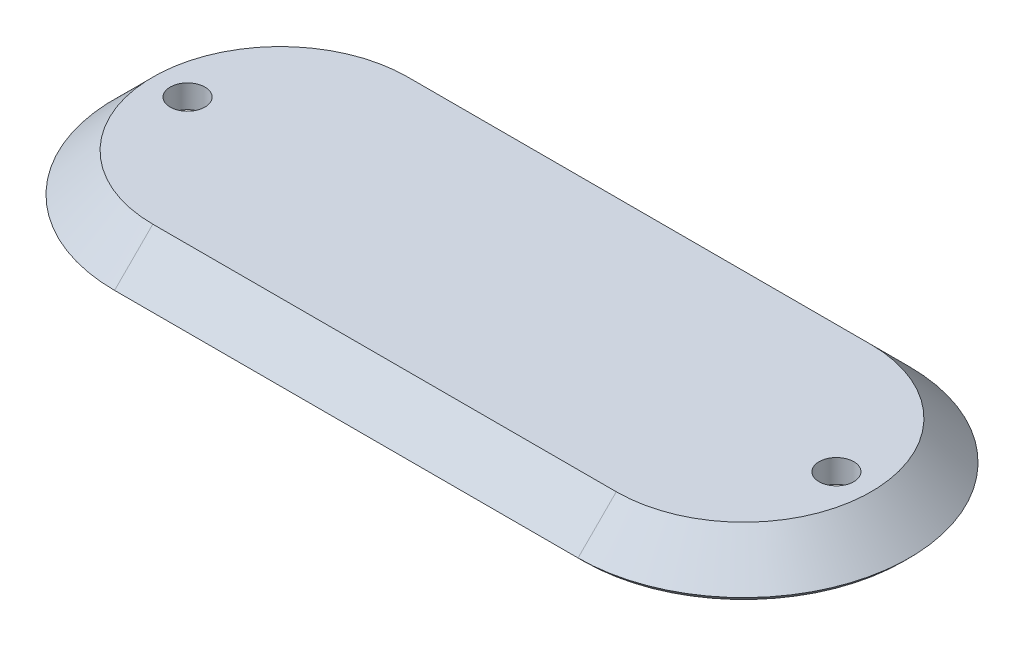
from build123d import *
from OCP.BRepFilletAPI import BRepFilletAPI_MakeChamfer

# Parameters (mm, degrees)
BOSS_EXTRU_1_DEPTH      = 3.8
BOSS_EXTRU_1_TAPER      = 45
COQUE2_DEPTH            = 1.8
COQUE2_DRAFT            = 45
CHANFREIN1_SIZE         = 1
CHANFREIN1_SIZE2        = 0.707106781
ENL_V_MAT_EXTRU_1_REACH = 39.355
ESQUISSE2_R             = 1.5


# Read off the part's stored shape, not the designer's step: Coque2
with BuildPart() as part:
    # Esquisse1 → Boss.-Extru.1 (new body)
    with BuildSketch(Plane(origin=(0, 0, 0), x_dir=(1, 0, 0), z_dir=(0, 1, 0))):
        with BuildLine():
            ThreePointArc((-20, 14.8), (-34.8, 0), (-20, -14.8))
            Line((-20, -14.8), (20, -14.8))
            ThreePointArc((20, -14.8), (34.8, 0), (20, 14.8))
            Line((20, 14.8), (-20, 14.8))
        make_face()
    extrude(amount=BOSS_EXTRU_1_DEPTH, taper=BOSS_EXTRU_1_TAPER)


with BuildPart() as coque2_tool:
    # Coque2 outline → Coque2 (with draft: the straight prism first)
    with BuildSketch(Plane(origin=(0, 1.8, 0), x_dir=(1, 0, 0), z_dir=(0, 1, 0))):
        with BuildLine():
            Line((-20, -10.171572875), (20, -10.171572875))
            ThreePointArc((20, -10.171572875), (30.171572875, 0), (20, 10.171572875))
            Line((20, 10.171572875), (-20, 10.171572875))
            ThreePointArc((-20, 10.171572875), (-30.171572875, 0), (-20, -10.171572875))
        make_face()
    extrude(amount=-COQUE2_DEPTH)
    # Coque2: the draft: its side faces are tilted about the plane it starts from
    coque2_sides = [coque2_tool.faces().sort_by_distance(p)[0] for p in [
        (0, 0.9, 10.171572875),
        (30.171572875, 0.9, 0),
        (0, 0.9, -10.171572875),
        (-30.171572875, 0.9, 0),
    ]]
    draft(coque2_sides, Plane(origin=(0, 1.8, 0), x_dir=(1, 0, 0), z_dir=(0, 1, 0)), COQUE2_DRAFT)


with BuildPart() as part_1:
    add(part.part)

    # Coque2: cut by coque2_tool
    add(coque2_tool.part, mode=Mode.SUBTRACT)

    # Chanfrein1: one chamfer whose edges measure the first distance from different faces: ONE call of the kernel's chamfer builder (chamfer() names one face for all edges)
    chanfrein1_edges_1 = [part_1.edges().sort_by_distance(p)[0] for p in [
        (0, 0, -14.8),
        (0, 0, 14.8),
        (-34.8, 0, 0),
    ]]
    chanfrein1_side_1 = [part_1.faces().sort_by_distance(p)[0] for p in [
        (0, 0, -14.043672029),
    ]]
    chanfrein1_edges_2 = [part_1.edges().sort_by_distance(p)[0] for p in [
        (34.8, 0, 0),
    ]]
    chanfrein1_side_2 = [part_1.faces().sort_by_distance(p)[0] for p in [
        (32.9, 1.9, 0),
    ]]
    chanfrein1 = BRepFilletAPI_MakeChamfer(part_1.part.solid().wrapped)
    for e in chanfrein1_edges_1:
        chanfrein1.Add(CHANFREIN1_SIZE, CHANFREIN1_SIZE2, e.wrapped, chanfrein1_side_1[0].wrapped)  # the first distance lies on this face
    for e in chanfrein1_edges_2:
        chanfrein1.Add(CHANFREIN1_SIZE, CHANFREIN1_SIZE2, e.wrapped, chanfrein1_side_2[0].wrapped)  # the first distance lies on this face
    add(Compound.cast(chanfrein1.Shape()), mode=Mode.REPLACE)

    # Esquisse2 → Enlèv. mat.-Extru.1 (cut, up to next)
    with BuildSketch(Plane(origin=(0, 3.8, 0), x_dir=(1, 0, 0), z_dir=(0, 1, 0)), mode=Mode.PRIVATE) as enl_v_mat_extru_1_sk1:
        with Locations(Location((-28, 0, 0), (0, 0, 270))):
            Circle(ESQUISSE2_R)
    enl_v_mat_extru_1_tool1 = extrude(enl_v_mat_extru_1_sk1.sketch, amount=-ENL_V_MAT_EXTRU_1_REACH, mode=Mode.PRIVATE) & part_1.part
    # Esquisse2 → Enlèv. mat.-Extru.1 (cut, up to next)
    with BuildSketch(Plane(origin=(0, 3.8, 0), x_dir=(1, 0, 0), z_dir=(0, 1, 0)), mode=Mode.PRIVATE) as enl_v_mat_extru_1_sk2:
        with Locations(Location((28, 0, 0), (0, 0, 270))):
            Circle(ESQUISSE2_R)
    enl_v_mat_extru_1_tool2 = extrude(enl_v_mat_extru_1_sk2.sketch, amount=-ENL_V_MAT_EXTRU_1_REACH, mode=Mode.PRIVATE) & part_1.part
    add(enl_v_mat_extru_1_tool1.solids().sort_by_distance((-28, 3.8, 0))[0], mode=Mode.SUBTRACT)
    add(enl_v_mat_extru_1_tool2.solids().sort_by_distance((28, 3.8, 0))[0], mode=Mode.SUBTRACT)


solid = part_1.part
